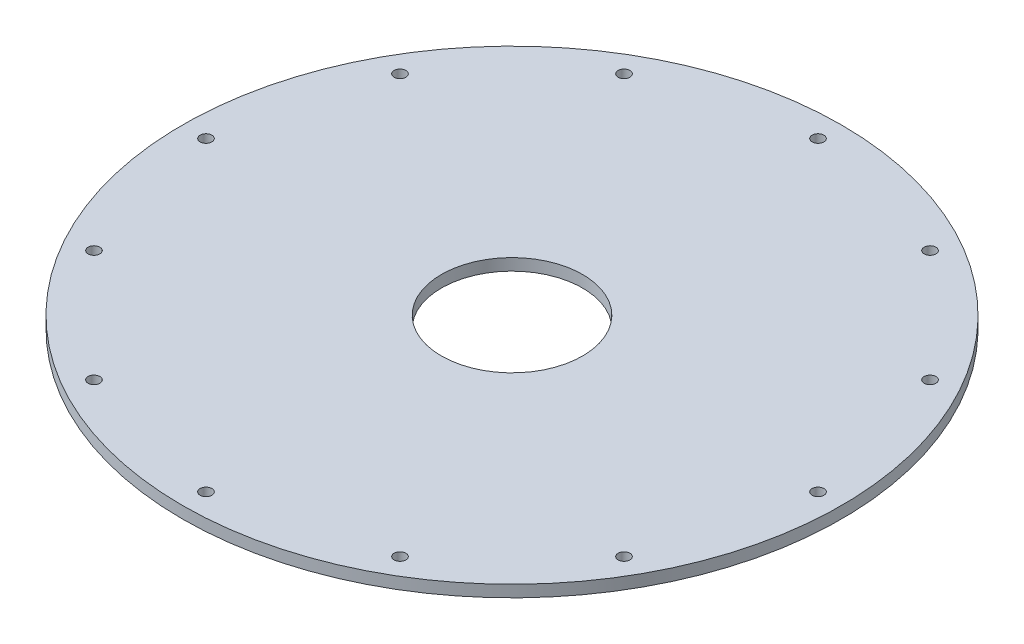
from build123d import *

# Parameters (mm, degrees)
SKETCH1_W                      = 34.925
SKETCH1_H                      = 1.5875
F_1_16_0_0625_DIAMETER_HOLE1_D = 1.5875
CIRPATTERN1_COUNT              = 12


with BuildPart() as part:
    # Sketch1 → Revolve1 (revolve)
    with BuildSketch(Plane.XY):
        with Locations((-26.9875, 0.79375)):
            Rectangle(SKETCH1_W, SKETCH1_H)
    revolve(axis=Axis((0, 55, 0), (0, -1, 0)))

    # 1/16 (0.0625) Diameter Hole1 (through all)
    with Locations(Plane(origin=(0, 1.5875, 0), x_dir=(1, 0, 0), z_dir=(0, 1, 0))):
        with Locations((-41.275, 0)):
            f_1_16_0_0625_diameter_hole1 = Hole(F_1_16_0_0625_DIAMETER_HOLE1_D / 2)

    # CirPattern1: 1/16 (0.0625) Diameter Hole1 ×12 about axis
    cirpattern1_axis = Axis((0, 55, 0), (0, -1, 0))
    for i in range(1, CIRPATTERN1_COUNT):
        add(f_1_16_0_0625_diameter_hole1.rotate(cirpattern1_axis, i * 360 / CIRPATTERN1_COUNT), mode=Mode.SUBTRACT)


solid = part.part
